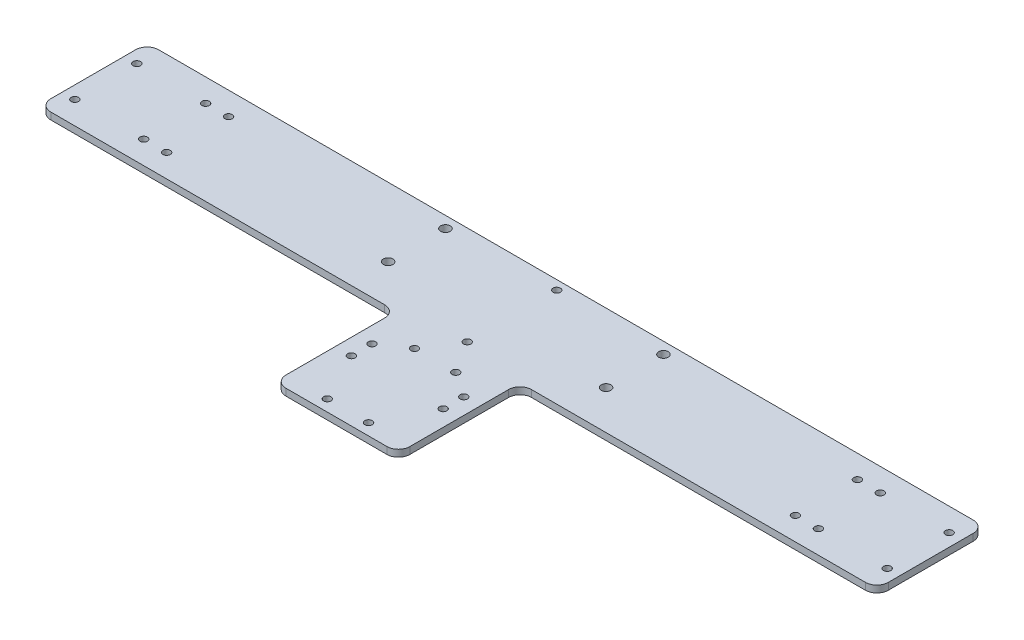
from build123d import *

# Parameters (mm, degrees)
SKETCH_1_R      = 1.6
SKETCH_1_R_2    = 2.1
EXTRUDE_1_DEPTH = 3
FILLET_1_R      = 5


with BuildPart() as part:
    # 草图1 → 凸台-拉伸1 (new body)
    with BuildSketch(Plane.XZ):
        Polygon((-27, 0), (27, 0), (27, -53), (182.5, -53), (182.5, -100), (-182.5, -100), (-182.5, -53), (-27, -53), align=None)
        with Locations((177, -63)):
            Circle(SKETCH_1_R, mode=Mode.SUBTRACT)
        with Locations((-177, -90)):
            Circle(SKETCH_1_R, mode=Mode.SUBTRACT)
        with Locations((-9, -43)):
            Circle(SKETCH_1_R, mode=Mode.SUBTRACT)
        with Locations((-9, -5)):
            Circle(SKETCH_1_R, mode=Mode.SUBTRACT)
        with Locations((-20, -35.5)):
            Circle(SKETCH_1_R, mode=Mode.SUBTRACT)
        with Locations((-20, -26.5)):
            Circle(SKETCH_1_R, mode=Mode.SUBTRACT)
        with Locations((-47.5, -95)):
            Circle(SKETCH_1_R_2, mode=Mode.SUBTRACT)
        with Locations((-47.5, -70)):
            Circle(SKETCH_1_R_2, mode=Mode.SUBTRACT)
        with Locations((-137, -63)):
            Circle(SKETCH_1_R, mode=Mode.SUBTRACT)
        with Locations((-137, -90)):
            Circle(SKETCH_1_R, mode=Mode.SUBTRACT)
        with Locations((-177, -63)):
            Circle(SKETCH_1_R, mode=Mode.SUBTRACT)
        with Locations((137, -90)):
            Circle(SKETCH_1_R, mode=Mode.SUBTRACT)
        with Locations((137, -63)):
            Circle(SKETCH_1_R, mode=Mode.SUBTRACT)
        with Locations((47.5, -70)):
            Circle(SKETCH_1_R_2, mode=Mode.SUBTRACT)
        with Locations((47.5, -95)):
            Circle(SKETCH_1_R_2, mode=Mode.SUBTRACT)
        with Locations((20, -26.5)):
            Circle(SKETCH_1_R, mode=Mode.SUBTRACT)
        with Locations((20, -35.5)):
            Circle(SKETCH_1_R, mode=Mode.SUBTRACT)
        with Locations((9, -5)):
            Circle(SKETCH_1_R, mode=Mode.SUBTRACT)
        with Locations((9, -43)):
            Circle(SKETCH_1_R, mode=Mode.SUBTRACT)
        with Locations((177, -90)):
            Circle(SKETCH_1_R, mode=Mode.SUBTRACT)
        with Locations((0, -57)):
            Circle(SKETCH_1_R, mode=Mode.SUBTRACT)
        with Locations((0, -96)):
            Circle(SKETCH_1_R, mode=Mode.SUBTRACT)
        with Locations((-147, -63)):
            Circle(SKETCH_1_R, mode=Mode.SUBTRACT)
        with Locations((-147, -90)):
            Circle(SKETCH_1_R, mode=Mode.SUBTRACT)
        with Locations((147, -63)):
            Circle(SKETCH_1_R, mode=Mode.SUBTRACT)
        with Locations((147, -90)):
            Circle(SKETCH_1_R, mode=Mode.SUBTRACT)
    extrude(amount=-EXTRUDE_1_DEPTH)

    # 圆角1
    fillet_1_edges = [part.edges().sort_by_distance(p)[0] for p in [
        (-182.5, 1.5, -100),
        (-182.5, 1.5, -53),
        (182.5, 1.5, -100),
        (182.5, 1.5, -53),
        (27, 1.5, -53),
        (27, 1.5, 0),
        (-27, 1.5, 0),
        (-27, 1.5, -53),
    ]]
    fillet(fillet_1_edges, radius=FILLET_1_R)


solid = part.part
